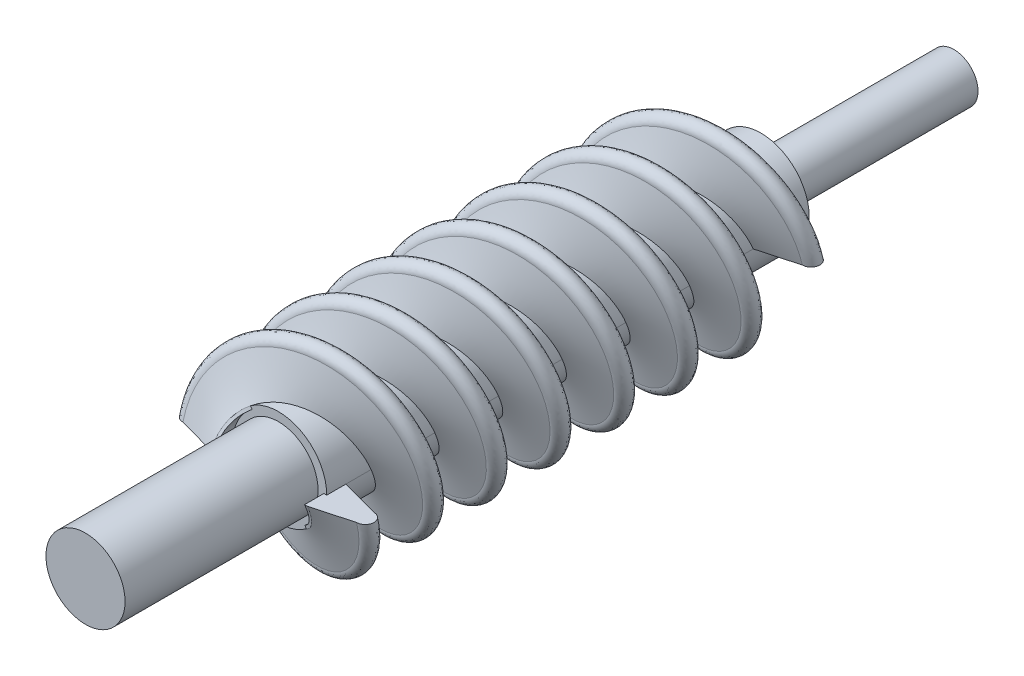
from build123d import *

# Parameters (mm, degrees)
ESQUISSE1_R             = 5
BOSS_EXTRU_1_DEPTH      = 50
BALAYAGE2_PITCH         = 13.2
CIRPATTERN1_COUNT       = 2
BOSS_EXTRU_3_DEPTH      = 20
BOSS_EXTRU_3_DEPTH_BACK = 70
ARBRE_R                 = 2.5
ESQUISSE8_R             = 4.1
BOSS_EXTRU_4_DEPTH      = 20


with BuildPart() as part:
    # Esquisse1 → Boss.-Extru.1 (new body)
    with BuildSketch(Plane.XY):
        Circle(ESQUISSE1_R)
    extrude(amount=BOSS_EXTRU_1_DEPTH)

    # Balayage2: the profile of Esquisse4 screwed along a right-hand helix of 3.5 turns, 18 arcs to a turn; built about Z, then put on its axis
    balayage2_z = Axis((0, 0, 0), (0, 0, 1))
    balayage2_corners = [(9, 0, 0.9), (5, 0, 2), (4.702014603, 0, 2), (4.702014603, 0, -2), (5, 0, -2), (9, 0, -0.9), (9.9, 0, 0)]
    with BuildLine(mode=Mode.PRIVATE) as balayage2_profile:
        Line(balayage2_corners[0], balayage2_corners[1])
        Line(balayage2_corners[1], balayage2_corners[2])
        Line(balayage2_corners[2], balayage2_corners[3])
        Line(balayage2_corners[3], balayage2_corners[4])
        Line(balayage2_corners[4], balayage2_corners[5])
        ThreePointArc((9, 0, -0.9), (9.636396103, 0, -0.636396103), (9.9, 0, 0))
        ThreePointArc((9.9, 0, 0), (9.636396103, 0, 0.636396103), (9, 0, 0.9))
    balayage2_cap = Face(balayage2_profile.wire())
    balayage2_arcs = [((9, 0, -0.9), (9.9, 0, -0.9), (9.9, 0, 0), (1, 0.7071067811865511, 1)), ((9.9, 0, 0), (9.9, 0, 0.9), (9, 0, 0.9), (1, 0.7071067811865511, 1))]  # start, shoulder, end, weights
    balayage2_turn_angles = [0, 10, 20, 30, 40, 50, 60, 70, 80, 90, 100, 110, 120, 130, 140, 150, 160, 170, 180, 190, 200, 210, 220, 230, 240, 250, 260, 270, 280, 290, 300, 310, 320, 330, 340, 350, 360]
    balayage2_turn_weights = [1, 0.984807753012208, 1, 0.984807753012208, 1, 0.984807753012208, 1, 0.984807753012208, 1, 0.984807753012208, 1, 0.984807753012208, 1, 0.984807753012208, 1, 0.984807753012208, 1, 0.984807753012208, 1, 0.984807753012208, 1, 0.984807753012208, 1, 0.984807753012208, 1, 0.984807753012208, 1, 0.984807753012208, 1, 0.984807753012208, 1, 0.984807753012208, 1, 0.984807753012208, 1, 0.984807753012208, 1]
    balayage2_turn_rails = [Edge.make_bspline([Vector(p[0], p[1], 0).rotate(balayage2_z, balayage2_turn_angles[k]) / balayage2_turn_weights[k] + Vector(0, 0, p[2] + BALAYAGE2_PITCH * balayage2_turn_angles[k] / 360) for k in range(37)], [0, 0, 0, 1, 1, 2, 2, 3, 3, 4, 4, 5, 5, 6, 6, 7, 7, 8, 8, 9, 9, 10, 10, 11, 11, 12, 12, 13, 13, 14, 14, 15, 15, 16, 16, 17, 17, 18, 18, 18], 2, balayage2_turn_weights) for p in balayage2_corners]
    balayage2_turn_sides = [*[Face.make_surface_from_curves(balayage2_turn_rails[p[0]], balayage2_turn_rails[p[1]]) for p in [(0, 1), (1, 2), (2, 3), (3, 4), (4, 5)]], *[Face.make_bezier_surface([[Vector(p[j][0], p[j][1], 0).rotate(balayage2_z, balayage2_turn_angles[2 * i + k]) / balayage2_turn_weights[2 * i + k] + Vector(0, 0, p[j][2] + BALAYAGE2_PITCH * balayage2_turn_angles[2 * i + k] / 360) for k in range(3)] for j in range(3)], [[p[3][j] * balayage2_turn_weights[2 * i + k] for k in range(3)] for j in range(3)]) for p in balayage2_arcs for i in range(18)]]
    balayage2_last_angles = [1080, 1090, 1100, 1110, 1120, 1130, 1140, 1150, 1160, 1170, 1180, 1190, 1200, 1210, 1220, 1230, 1240, 1250, 1260]
    balayage2_last_weights = [1, 0.984807753012208, 1, 0.984807753012208, 1, 0.984807753012208, 1, 0.984807753012208, 1, 0.984807753012208, 1, 0.984807753012208, 1, 0.984807753012208, 1, 0.984807753012208, 1, 0.9848077530122057, 1]
    balayage2_last_rails = [Edge.make_bspline([Vector(p[0], p[1], 0).rotate(balayage2_z, balayage2_last_angles[k]) / balayage2_last_weights[k] + Vector(0, 0, p[2] + BALAYAGE2_PITCH * balayage2_last_angles[k] / 360) for k in range(19)], [0, 0, 0, 1, 1, 2, 2, 3, 3, 4, 4, 5, 5, 6, 6, 7, 7, 8, 8, 9, 9, 9], 2, balayage2_last_weights) for p in balayage2_corners]
    balayage2_last_sides = [*[Face.make_surface_from_curves(balayage2_last_rails[p[0]], balayage2_last_rails[p[1]]) for p in [(0, 1), (1, 2), (2, 3), (3, 4), (4, 5)]], *[Face.make_bezier_surface([[Vector(p[j][0], p[j][1], 0).rotate(balayage2_z, balayage2_last_angles[2 * i + k]) / balayage2_last_weights[2 * i + k] + Vector(0, 0, p[j][2] + BALAYAGE2_PITCH * balayage2_last_angles[2 * i + k] / 360) for k in range(3)] for j in range(3)], [[p[3][j] * balayage2_last_weights[2 * i + k] for k in range(3)] for j in range(3)]) for p in balayage2_arcs for i in range(9)]]
    balayage2 = Plane(origin=(0, 0, 50), x_dir=(-1, 0, 0), z_dir=(0, 0, -1)) * Solid(Shell([*[p.moved(Location((0, 0, BALAYAGE2_PITCH * i))) for i in range(3) for p in balayage2_turn_sides], *balayage2_last_sides, balayage2_cap, balayage2_cap.rotate(balayage2_z, 1260).moved(Location((0, 0, BALAYAGE2_PITCH * 1260 / 360)))]))
    add(balayage2)

    # CirPattern1: Balayage2 ×2 about axis
    cirpattern1_axis = Axis((0, 0, 50), (0, 0, -1))
    for i in range(1, CIRPATTERN1_COUNT):
        add(balayage2.rotate(cirpattern1_axis, i * 360 / CIRPATTERN1_COUNT))

    # arbre → Boss.-Extru.3 (add, two sides: drawn at the far end of the back side and taken through both)
    with BuildSketch(Plane(origin=(0, 0, 0), x_dir=(-1, 0, 0), z_dir=(0, 0, -1)).offset(-BOSS_EXTRU_3_DEPTH_BACK)):
        Circle(ARBRE_R)
    extrude(amount=BOSS_EXTRU_3_DEPTH + BOSS_EXTRU_3_DEPTH_BACK)

    # Esquisse8 → Boss.-Extru.4 (add)
    with BuildSketch(Plane.XY.offset(70)):
        Circle(ESQUISSE8_R)
    extrude(amount=-BOSS_EXTRU_4_DEPTH)


solid = part.part
